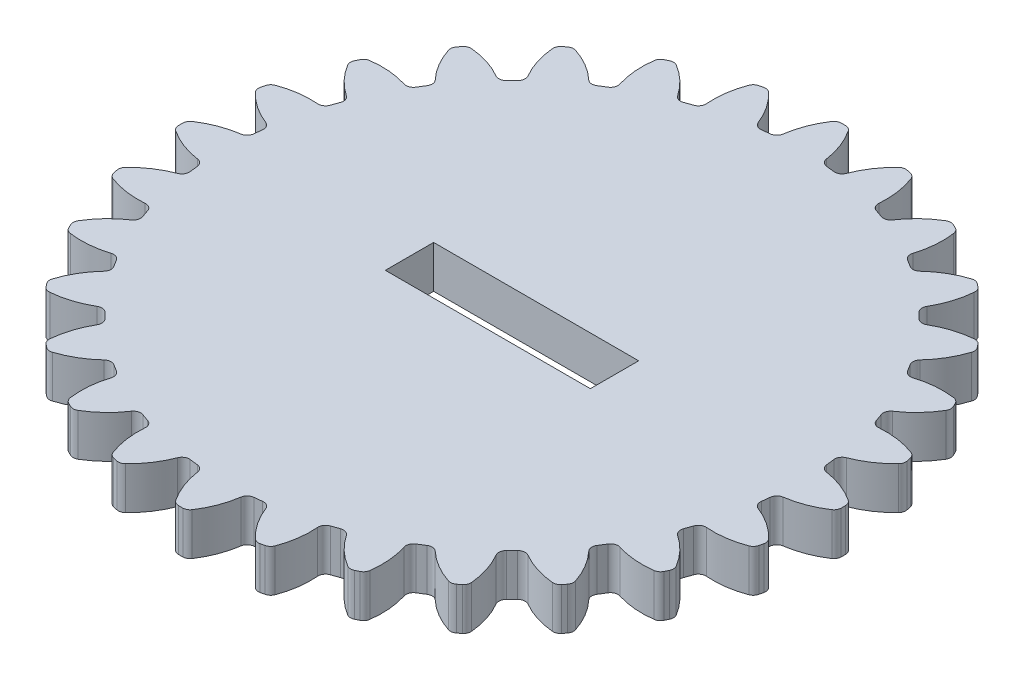
from build123d import *
from build123d.topology import SkipClean

# Parameters (mm, degrees)
SKETCH1_R                = 19.375
BASE_FLANGE2_DEPTH       = 2.85
TAB1_START               = -2.85
TAB1_DEPTH               = 2.85
FILLET1_R                = 0.5
CIRPATTERN1_COUNT        = 28
FILLET1_OF_CIRPATTERN1_R = 0.5
CUT_EXTRUDE1_DEPTH       = 32.665478198
SKETCH13_R               = 1.625
CUT_EXTRUDE2_DEPTH       = 32.665478198
SKETCH14_W               = 13.8
SKETCH14_H               = 3.25
CUT_EXTRUDE3_DEPTH       = 32.665478198


# Read off the part's stored shape, not the designer's step: Tab1
# Sheet-metal steps are written as plain solids
with BuildPart() as part:
    # Sketch1 → Base-Flange2 (new body)
    with BuildSketch(Plane(origin=(0, 0, 0), x_dir=(1, 0, 0), z_dir=(0, 1, 0))):
        with Locations(Location((0, 0, 0), (0, 0, 270))):
            Circle(SKETCH1_R)
    extrude(amount=-BASE_FLANGE2_DEPTH)

    # Tab1 outline → Tab1 (add)
    with BuildSketch(Plane(origin=(0, 0, 0), x_dir=(1, 0, 0), z_dir=(0, 1, 0)).offset(TAB1_START)):
        with BuildLine():
            ThreePointArc((0.4, 22.296412267), (0, 22.3), (-0.4, 22.296412267))
            ThreePointArc((-0.4, 22.296412267), (-1.157728924, 20.883319923), (-1.5, 19.316848216))
            ThreePointArc((-1.5, 19.316848216), (0, 19.375), (1.5, 19.316848216))
            ThreePointArc((1.5, 19.316848216), (1.157728924, 20.883319923), (0.4, 22.296412267))
        make_face()
    tab1 = extrude(amount=TAB1_DEPTH)

    # Fillet1
    fillet1_edges = [part.edges().sort_by_distance(p)[0] for p in [
        (-1.5, -1.425, -19.316848216),
        (-0.4, -1.425, -22.296412267),
        (0.4, -1.425, -22.296412267),
        (1.5, -1.425, -19.316848216),
    ]]
    fillet(fillet1_edges, radius=FILLET1_R)

    # CirPattern1: Tab1 ×28 about axis
    cirpattern1_axis = Axis((0, 0, 0), (0, 1, 0))
    for i in range(1, CIRPATTERN1_COUNT):
        add(tab1.rotate(cirpattern1_axis, i * 360 / CIRPATTERN1_COUNT))

    # Fillet1 of CirPattern1
    fillet1_of_cirpattern1_edges = [part.edges().sort_by_distance(p)[0] for p in [
        (-5.760794974, -1.425, -18.4987531),
        (-5.351389646, -1.425, -21.648386287),
        (-4.571447317, -1.425, -21.826403034),
        (-2.836011238, -1.425, -19.166315902),
        (-9.732719634, -1.425, -16.75305326),
        (-10.03443827, -1.425, -19.914819823),
        (-9.313663176, -1.425, -20.261926814),
        (-7.02981303, -1.425, -18.054704477),
        (-13.21660509, -1.425, -14.167285375),
        (-14.214318259, -1.425, -17.182641136),
        (-13.588853074, -1.425, -17.681432977),
        (-10.871110643, -1.425, -16.03775478),
        (-16.03775478, -1.425, -10.871110643),
        (-17.681432977, -1.425, -13.588853074),
        (-17.182641136, -1.425, -14.214318259),
        (-14.167285375, -1.425, -13.21660509),
        (-18.054704477, -1.425, -7.02981303),
        (-20.261926814, -1.425, -9.313663176),
        (-19.914819823, -1.425, -10.03443827),
        (-16.75305326, -1.425, -9.732719634),
        (-19.166315902, -1.425, -2.836011238),
        (-21.826403034, -1.425, -4.571447317),
        (-21.648386287, -1.425, -5.351389646),
        (-18.4987531, -1.425, -5.760794974),
        (-19.316848216, -1.425, 1.5),
        (-22.296412267, -1.425, 0.4),
        (-22.296412267, -1.425, -0.4),
        (-19.316848216, -1.425, -1.5),
        (-18.4987531, -1.425, 5.760794974),
        (-21.648386287, -1.425, 5.351389646),
        (-21.826403034, -1.425, 4.571447317),
        (-19.166315902, -1.425, 2.836011238),
        (-16.75305326, -1.425, 9.732719634),
        (-19.914819823, -1.425, 10.03443827),
        (-20.261926814, -1.425, 9.313663176),
        (-18.054704477, -1.425, 7.02981303),
        (-14.167285375, -1.425, 13.21660509),
        (-17.182641136, -1.425, 14.214318259),
        (-17.681432977, -1.425, 13.588853074),
        (-16.03775478, -1.425, 10.871110643),
        (-10.871110643, -1.425, 16.03775478),
        (-13.588853074, -1.425, 17.681432977),
        (-14.214318259, -1.425, 17.182641136),
        (-13.21660509, -1.425, 14.167285375),
        (-7.02981303, -1.425, 18.054704477),
        (-9.313663176, -1.425, 20.261926814),
        (-10.03443827, -1.425, 19.914819823),
        (-9.732719634, -1.425, 16.75305326),
        (-2.836011238, -1.425, 19.166315902),
        (-4.571447317, -1.425, 21.826403034),
        (-5.351389646, -1.425, 21.648386287),
        (-5.760794974, -1.425, 18.4987531),
        (1.5, -1.425, 19.316848216),
        (0.4, -1.425, 22.296412267),
        (-0.4, -1.425, 22.296412267),
        (-1.5, -1.425, 19.316848216),
        (5.760794974, -1.425, 18.4987531),
        (5.351389646, -1.425, 21.648386287),
        (4.571447317, -1.425, 21.826403034),
        (2.836011238, -1.425, 19.166315902),
        (9.732719634, -1.425, 16.75305326),
        (10.03443827, -1.425, 19.914819823),
        (9.313663176, -1.425, 20.261926814),
        (7.02981303, -1.425, 18.054704477),
        (13.21660509, -1.425, 14.167285375),
        (14.214318259, -1.425, 17.182641136),
        (13.588853074, -1.425, 17.681432977),
        (10.871110643, -1.425, 16.03775478),
        (16.03775478, -1.425, 10.871110643),
        (17.681432977, -1.425, 13.588853074),
        (17.182641136, -1.425, 14.214318259),
        (14.167285375, -1.425, 13.21660509),
        (18.054704477, -1.425, 7.02981303),
        (20.261926814, -1.425, 9.313663176),
        (19.914819823, -1.425, 10.03443827),
        (16.75305326, -1.425, 9.732719634),
        (19.166315902, -1.425, 2.836011238),
        (21.826403034, -1.425, 4.571447317),
        (21.648386287, -1.425, 5.351389646),
        (18.4987531, -1.425, 5.760794974),
        (19.316848216, -1.425, -1.5),
        (22.296412267, -1.425, -0.4),
        (22.296412267, -1.425, 0.4),
        (19.316848216, -1.425, 1.5),
        (18.4987531, -1.425, -5.760794974),
        (21.648386287, -1.425, -5.351389646),
        (21.826403034, -1.425, -4.571447317),
        (19.166315902, -1.425, -2.836011238),
        (16.75305326, -1.425, -9.732719634),
        (19.914819823, -1.425, -10.03443827),
        (20.261926814, -1.425, -9.313663176),
        (18.054704477, -1.425, -7.02981303),
        (14.167285375, -1.425, -13.21660509),
        (17.182641136, -1.425, -14.214318259),
        (17.681432977, -1.425, -13.588853074),
        (16.03775478, -1.425, -10.871110643),
        (10.871110643, -1.425, -16.03775478),
        (13.588853074, -1.425, -17.681432977),
        (14.214318259, -1.425, -17.182641136),
        (13.21660509, -1.425, -14.167285375),
        (7.02981303, -1.425, -18.054704477),
        (9.313663176, -1.425, -20.261926814),
        (10.03443827, -1.425, -19.914819823),
        (9.732719634, -1.425, -16.75305326),
        (2.836011238, -1.425, -19.166315902),
        (4.571447317, -1.425, -21.826403034),
        (5.351389646, -1.425, -21.648386287),
        (5.760794974, -1.425, -18.4987531),
    ]]
    fillet(fillet1_of_cirpattern1_edges, radius=FILLET1_OF_CIRPATTERN1_R)

    # Sketch11 → Cut-Extrude1 (cut, through all)
    with BuildSketch(Plane(origin=(0, 0, 0), x_dir=(1, 0, 0), z_dir=(0, 1, 0))):
        with BuildLine():
            Line((-1.369306394, 0.875), (1.369306394, 0.875))
            ThreePointArc((1.369306394, 0.875), (0, -1.625), (-1.369306394, 0.875))
        make_face()
    extrude(amount=-CUT_EXTRUDE1_DEPTH, mode=Mode.SUBTRACT)

    # Sketch13 → Cut-Extrude2 (cut, through all)
    with SkipClean():  # the faces are left unmerged after this step: merging them gives an invalid solid
        with BuildSketch(Plane(origin=(0, 0, 0), x_dir=(1, 0, 0), z_dir=(0, 1, 0))):
            with Locations(Location((0, 0, 0), (0, 0, 270))):
                Circle(SKETCH13_R)
        extrude(amount=-CUT_EXTRUDE2_DEPTH, mode=Mode.SUBTRACT)

    # Sketch14 → Cut-Extrude3 (cut, through all)
    with BuildSketch(Plane(origin=(0, 0, 0), x_dir=(1, 0, 0), z_dir=(0, 1, 0))):
        Rectangle(SKETCH14_W, SKETCH14_H)
    extrude(amount=-CUT_EXTRUDE3_DEPTH, mode=Mode.SUBTRACT)


solid = part.part
